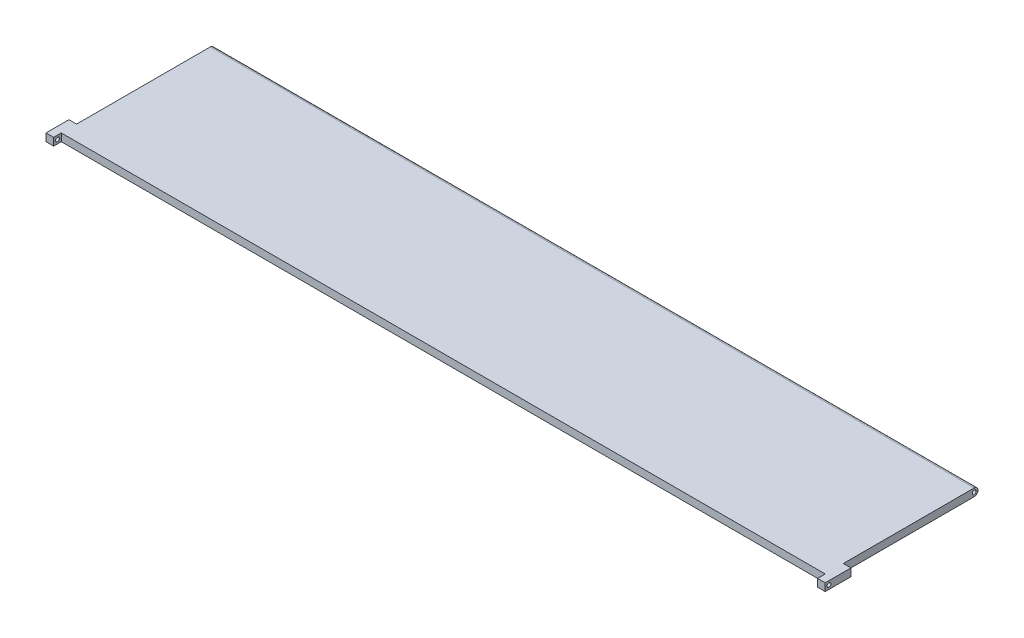
from build123d import *

# Parameters (mm, degrees)
SKETCH1_W           = 200
SKETCH1_H           = 40
BOSS_EXTRUDE1_DEPTH = 2
SKETCH2_W           = 6.740804159
SKETCH2_H           = 2
SKETCH2_R           = 0.5
BOSS_EXTRUDE2_DEPTH = 2
BOSS_EXTRUDE3_START = 2
SKETCH3_W           = 6
SKETCH3_H           = 2
SKETCH3_R           = 0.5
BOSS_EXTRUDE3_DEPTH = 2
SKETCH4_R           = 0.5
CUT_EXTRUDE1_DEPTH  = 204.204330663
FILLET2_R           = 1


with BuildPart() as part:
    # Sketch1 → Boss-Extrude1 (new body)
    with BuildSketch(Plane(origin=(0, 0, 0), x_dir=(1, 0, 0), z_dir=(0, 1, 0))):
        Rectangle(SKETCH1_W, SKETCH1_H)
    extrude(amount=BOSS_EXTRUDE1_DEPTH)

    # Sketch2 → Boss-Extrude2 (add)
    with BuildSketch(Plane(origin=(100, 0, 0), x_dir=(0, 0, -1), z_dir=(1, 0, 0))):
        with Locations((-18.629597921, 1)):
            Rectangle(SKETCH2_W, SKETCH2_H)
        with Locations((-21, 1)):
            Circle(SKETCH2_R, mode=Mode.SUBTRACT)
    extrude(amount=BOSS_EXTRUDE2_DEPTH)

    # Sketch3 → Boss-Extrude3 (add)
    with BuildSketch(Plane.ZY.offset(100).offset(BOSS_EXTRUDE3_START)):
        with Locations((19, 1)):
            Rectangle(SKETCH3_W, SKETCH3_H)
        with Locations(Location((21, 1, 0), (0, 0, 180))):
            Circle(SKETCH3_R, mode=Mode.SUBTRACT)
    extrude(amount=-BOSS_EXTRUDE3_DEPTH)

    # Sketch4 → Cut-Extrude1 (cut, through all)
    with BuildSketch(Plane.ZY.offset(100)):
        with Locations((-19, 1)):
            Circle(SKETCH4_R)
    extrude(amount=-CUT_EXTRUDE1_DEPTH, mode=Mode.SUBTRACT)

    # Fillet2
    fillet2_edges = [part.edges().sort_by_distance(p)[0] for p in [
        (0, 0, -20),
        (0, 2, -20),
    ]]
    fillet(fillet2_edges, radius=FILLET2_R - 0.0001)  # a hair under: the kernel refuses the full size


solid = part.part
